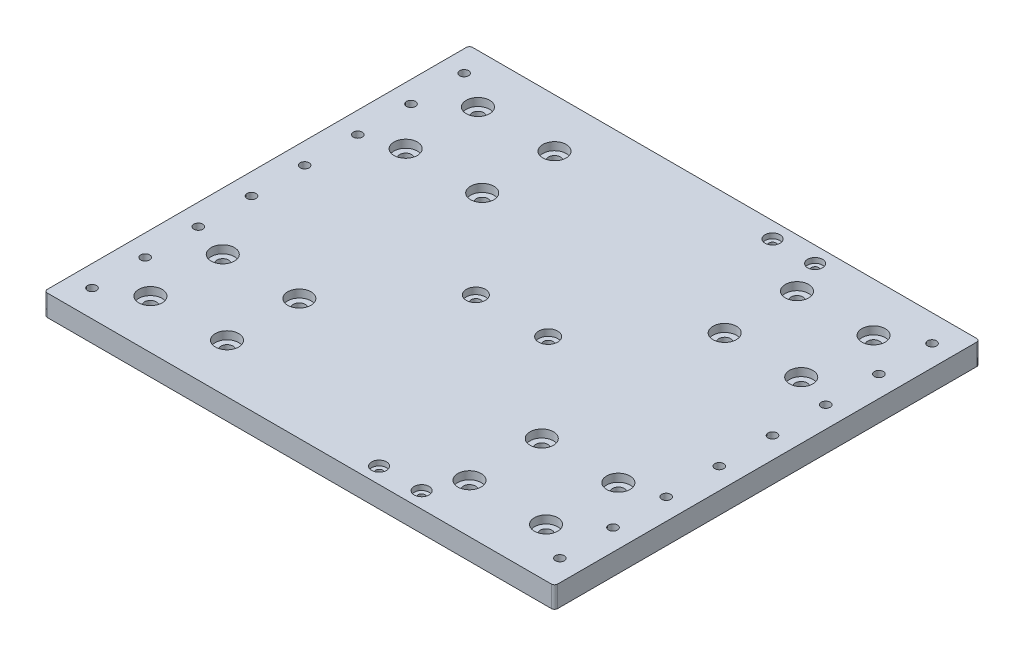
from build123d import *

# Parameters (mm, degrees)
SKETCH1_W                                        = 240
SKETCH1_H                                        = 200
BOSS_EXTRUDE1_DEPTH                              = 5
CBORE_FOR_M5_PAN_HEAD_MACHINE_SCREW1_D           = 5.5
CBORE_FOR_M5_PAN_HEAD_MACHINE_SCREW1_CBORE_D     = 11
CBORE_FOR_M5_PAN_HEAD_MACHINE_SCREW1_CBORE_DEPTH = 3.7
MIRROR2_COPY_1_D                                 = 5.5
MIRROR2_COPY_1_CBORE_D                           = 11
MIRROR2_COPY_1_CBORE_DEPTH                       = 3.7
MIRROR2_COPY_2_D                                 = 5.5
MIRROR2_COPY_2_CBORE_D                           = 11
MIRROR2_COPY_2_CBORE_DEPTH                       = 3.7
CBORE_FOR_M4_PAN_HEAD_MACHINE_SCREW1_D           = 4.5
CBORE_FOR_M4_PAN_HEAD_MACHINE_SCREW1_CBORE_D     = 9
CBORE_FOR_M4_PAN_HEAD_MACHINE_SCREW1_CBORE_DEPTH = 3.1
M5X0_8_TAPPED_HOLE1_D                            = 4.2
FILLET1_R                                        = 1.5
LPATTERN2_COUNT                                  = 8
LPATTERN2_PITCH                                  = 25
CBORE_FOR_M3_PAN_HEAD_MACHINE_SCREW1_D           = 3.2
CBORE_FOR_M3_PAN_HEAD_MACHINE_SCREW1_CBORE_D     = 7
CBORE_FOR_M3_PAN_HEAD_MACHINE_SCREW1_CBORE_DEPTH = 2.4


with BuildPart() as part:
    # Sketch1 → Boss-Extrude1 (new, symmetric)
    with BuildSketch(Plane(origin=(0, 0, 0), x_dir=(1, 0, 0), z_dir=(0, 1, 0))):
        Rectangle(SKETCH1_W, SKETCH1_H)
    extrude(amount=BOSS_EXTRUDE1_DEPTH, both=True)

    # CBORE for M5 Pan Head Machine Screw1 (through all)
    with Locations(Plane(origin=(66.92305649, 5, -81.969265096), x_dir=(-1, 0, 0), z_dir=(0, 1, 0))):
        with Locations((159.92305649, 158.969265096), (123.92305649, 158.969265096), (123.92305649, 124.969265096), (159.92305649, 124.969265096)):
            cbore_for_m5_pan_head_machine_screw1 = CounterBoreHole(CBORE_FOR_M5_PAN_HEAD_MACHINE_SCREW1_D / 2, CBORE_FOR_M5_PAN_HEAD_MACHINE_SCREW1_CBORE_D / 2, CBORE_FOR_M5_PAN_HEAD_MACHINE_SCREW1_CBORE_DEPTH)

    # Mirror1: CBORE for M5 Pan Head Machine Screw1 across plane
    add(cbore_for_m5_pan_head_machine_screw1.mirror(Plane(origin=(0, 0, 0), x_dir=(0, 0, 1), z_dir=(1, 0, 0))), mode=Mode.SUBTRACT)

    # Mirror2 copy 1 (through all)
    with Locations(Plane(origin=(-66.92305649, 5, 81.969265096), x_dir=(1, 0, 0), z_dir=(0, 1, 0))):
        with Locations((159.92305649, 158.969265096), (123.92305649, 158.969265096), (123.92305649, 124.969265096), (159.92305649, 124.969265096)):
            CounterBoreHole(MIRROR2_COPY_1_D / 2, MIRROR2_COPY_1_CBORE_D / 2, MIRROR2_COPY_1_CBORE_DEPTH)

    # Mirror2 copy 2 (through all)
    with Locations(Plane(origin=(66.92305649, 5, 81.969265096), x_dir=(-1, 0, 0), z_dir=(0, 1, 0))):
        with Locations((159.92305649, -158.969265096), (123.92305649, -158.969265096), (123.92305649, -124.969265096), (159.92305649, -124.969265096)):
            CounterBoreHole(MIRROR2_COPY_2_D / 2, MIRROR2_COPY_2_CBORE_D / 2, MIRROR2_COPY_2_CBORE_DEPTH)

    # CBORE for M4 Pan Head Machine Screw1 (through all)
    with Locations(Plane(origin=(-30.338508942, 5, -23.538498317), x_dir=(-1, 0, 0), z_dir=(0, 1, 0))):
        with Locations((-13.338508942, 23.538498317), (-47.338508942, 23.538498317)):
            CounterBoreHole(CBORE_FOR_M4_PAN_HEAD_MACHINE_SCREW1_D / 2, CBORE_FOR_M4_PAN_HEAD_MACHINE_SCREW1_CBORE_D / 2, CBORE_FOR_M4_PAN_HEAD_MACHINE_SCREW1_CBORE_DEPTH)

    # M5x0.8 Tapped Hole1 (through all)
    with Locations(Plane(origin=(0, 5, 0), x_dir=(1, 0, 0), z_dir=(0, 1, 0))):
        with Locations((-110, 87.5), (110, 87.5)):
            m5x0_8_tapped_hole1 = Hole(M5X0_8_TAPPED_HOLE1_D / 2)

    # Fillet1
    fillet1_edges = [part.edges().sort_by_distance(p)[0] for p in [
        (-120, 0, -100),
        (120, 0, -100),
        (-120, 0, 100),
        (120, 0, 100),
    ]]
    fillet(fillet1_edges, radius=FILLET1_R)

    # LPattern2: M5x0.8 Tapped Hole1 ×8
    with Locations(*[(0, 0, i * LPATTERN2_PITCH) for i in range(1, LPATTERN2_COUNT)]):
        add(m5x0_8_tapped_hole1, mode=Mode.SUBTRACT)

    # CBORE for M3 Pan Head Machine Screw1 (through all)
    with Locations(Plane(origin=(0, 5, 0), x_dir=(1, 0, 0), z_dir=(0, 1, 0))):
        with Locations((30, 92.5), (50, 92.5)):
            cbore_for_m3_pan_head_machine_screw1 = CounterBoreHole(CBORE_FOR_M3_PAN_HEAD_MACHINE_SCREW1_D / 2, CBORE_FOR_M3_PAN_HEAD_MACHINE_SCREW1_CBORE_D / 2, CBORE_FOR_M3_PAN_HEAD_MACHINE_SCREW1_CBORE_DEPTH)

    # Mirror3: CBORE for M3 Pan Head Machine Screw1 across plane
    add(cbore_for_m3_pan_head_machine_screw1.mirror(Plane.XY), mode=Mode.SUBTRACT)


solid = part.part
